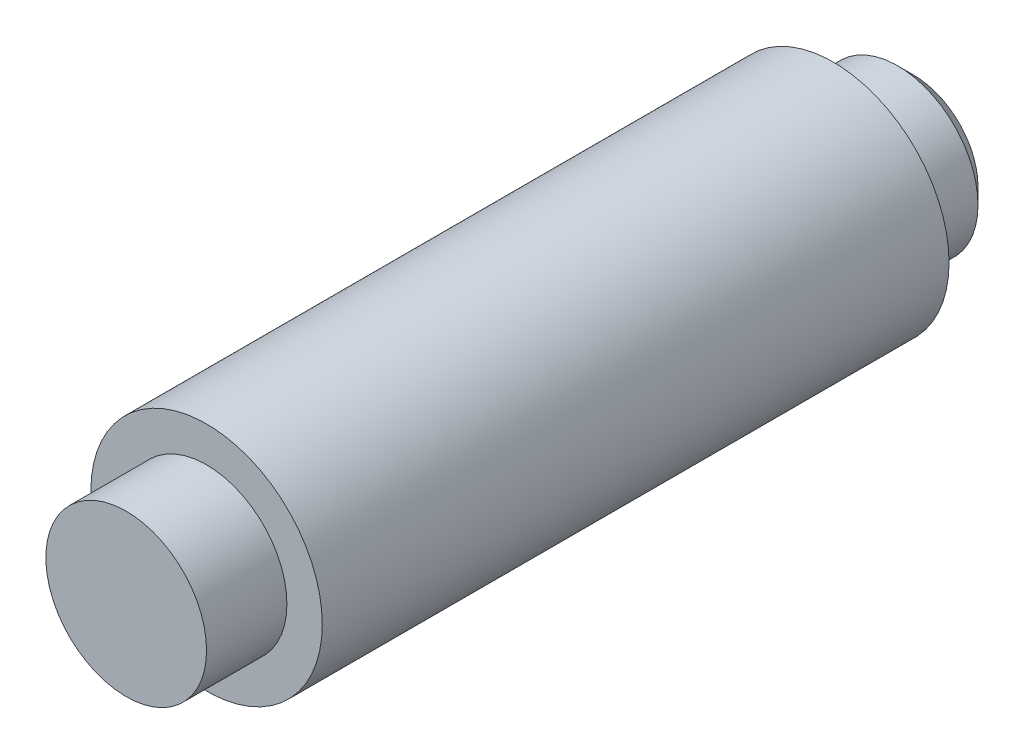
from build123d import *

# Parameters (mm, degrees)
SKETCH3_R           = 3.6
BOSS_EXTRUDE1_DEPTH = 19.5
SKETCH4_R           = 2.5
BOSS_EXTRUDE2_DEPTH = 2.5
BOSS_EXTRUDE3_START = 2.5
SKETCH5_R           = 2.5
BOSS_EXTRUDE3_DEPTH = 2.5
CHAMFER1_SIZE       = 0.5


with BuildPart() as part:
    # Sketch3 → Boss-Extrude1 (new body)
    with BuildSketch(Plane.XY):
        Circle(SKETCH3_R)
    extrude(amount=BOSS_EXTRUDE1_DEPTH)

    # Sketch4 → Boss-Extrude2 (add)
    with BuildSketch(Plane.XY):
        Circle(SKETCH4_R)
    extrude(amount=-BOSS_EXTRUDE2_DEPTH)

    # Sketch5 → Boss-Extrude3 (add)
    with BuildSketch(Plane.XY.offset(19.5).offset(BOSS_EXTRUDE3_START)):
        Circle(SKETCH5_R)
    extrude(amount=-BOSS_EXTRUDE3_DEPTH)

    # Chamfer1
    chamfer1_edges = [part.edges().sort_by_distance(p)[0] for p in [
        (-2.5, 0, -2.5),
    ]]
    chamfer(chamfer1_edges, length=CHAMFER1_SIZE)


solid = part.part
